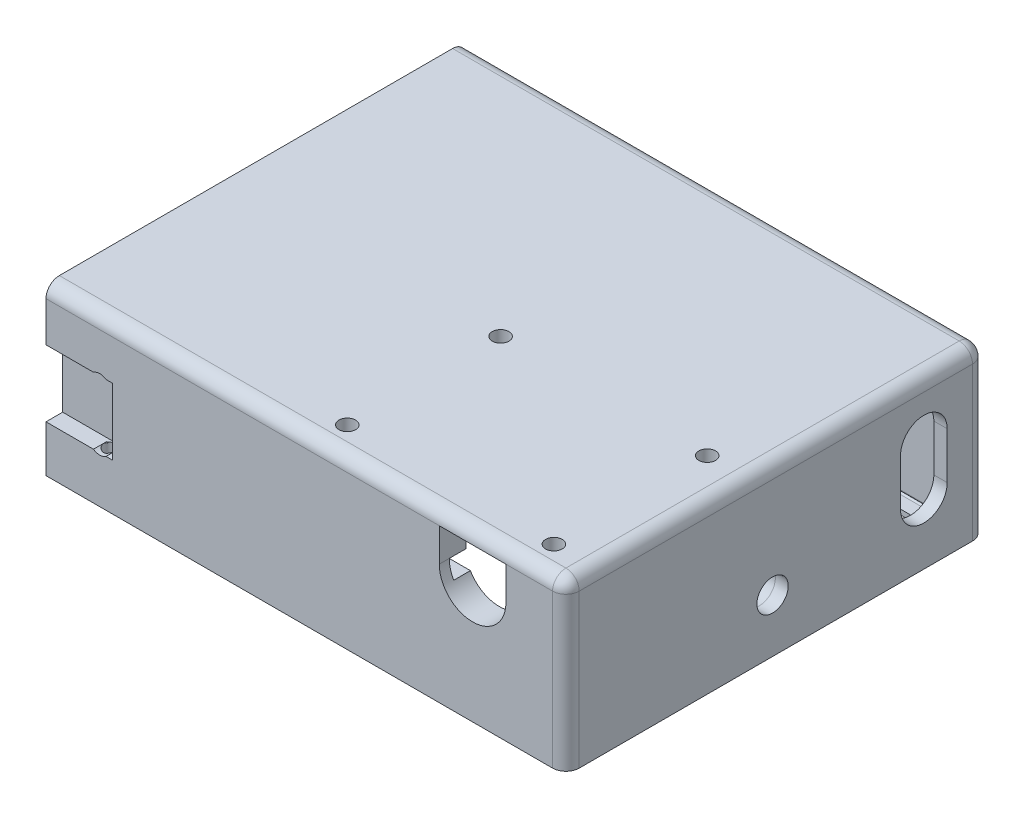
from build123d import *

# Parameters (mm, degrees)
SKETCH1_W               = 80
SKETCH1_H               = 63
BOSS_EXTRUDE2_DEPTH     = 25
SKETCH1_4_W             = 76
SKETCH1_4_H             = 55
CUT_EXTRUDE1_DEPTH      = 23
SKETCH4_W               = 2
SKETCH4_H               = 55
BOSS_EXTRUDE3_DEPTH     = 10
FILLET1_R               = 2
SKETCH5_W               = 2
SKETCH5_H               = 63
CUT_EXTRUDE3_DEPTH      = 105.852277038
SKETCH6_W               = 2.2
SKETCH6_H               = 2.2
CUT_EXTRUDE4_DEPTH      = 76
SKETCH7_W               = 10
SKETCH7_H               = 10
CUT_EXTRUDE5_DEPTH      = 2.5
CUT_EXTRUDE6_DEPTH      = 11.5
CUT_EXTRUDE6_DEPTH_BACK = 1.5
SKETCH8_R               = 0.875
SKETCH9_W               = 10
SKETCH9_H               = 10
CUT_EXTRUDE7_DEPTH      = 2.5
CUT_EXTRUDE8_DEPTH      = 11.5
CUT_EXTRUDE8_DEPTH_BACK = 1.5
SKETCH10_R              = 0.875
CUT_EXTRUDE9_DEPTH      = 2
CUT_EXTRUDE10_DEPTH     = 2
FILLET2_R               = 0.3
CUT_EXTRUDE13_REACH     = 86.524
SKETCH15_W              = 5
SKETCH15_H              = 10
FILLET3_R               = 1
SKETCH18_R              = 2.35
CUT_EXTRUDE16_DEPTH     = 15
CUT_EXTRUDE16_DRAFT     = 2
SKETCH19_R              = 1.25
CUT_EXTRUDE17_DEPTH     = 10
CUT_EXTRUDE18_REACH     = 106.852
SKETCH17_R              = 5
SKETCH20_R              = 3.5
SKETCH20_R_2            = 2.419841539
BOSS_EXTRUDE4_DEPTH     = 5
SKETCH21_R              = 0.75
CUT_EXTRUDE19_DEPTH     = 10
SKETCH22_W              = 38
SKETCH22_H              = 2.5
CUT_EXTRUDE20_DEPTH     = 2.5
SKETCH23_W              = 10
SKETCH23_H              = 5
CUT_EXTRUDE21_DEPTH     = 10
SKETCH24_W              = 12
SKETCH24_H              = 7
CUT_EXTRUDE22_DEPTH     = 2
CUT_EXTRUDE23_DEPTH     = 2


with BuildPart() as part:
    # Sketch1 → Boss-Extrude2 (new body)
    with BuildSketch(Plane(origin=(0, 0, 0), x_dir=(1, 0, 0), z_dir=(0, 1, 0))):
        with Locations((40, 31.5)):
            Rectangle(SKETCH1_W, SKETCH1_H)
    extrude(amount=BOSS_EXTRUDE2_DEPTH)

    # Sketch1<4> → Cut-Extrude1 (cut)
    with BuildSketch(Plane(origin=(0, 0, 0), x_dir=(1, 0, 0), z_dir=(0, 1, 0))):
        with Locations((40, 31.5)):
            Rectangle(SKETCH1_4_W, SKETCH1_4_H)
    extrude(amount=CUT_EXTRUDE1_DEPTH, mode=Mode.SUBTRACT)

    # Sketch4 → Boss-Extrude3 (add)
    with BuildSketch(Plane.XZ.offset(-23)):
        with Locations((30.5, -31.5)):
            Rectangle(SKETCH4_W, SKETCH4_H)
    extrude(amount=BOSS_EXTRUDE3_DEPTH)

    # Fillet1
    fillet1_edges = [part.edges().sort_by_distance(p)[0] for p in [
        (80, 25, -31.5),
        (40, 25, 0),
        (0, 25, -31.5),
        (0, 12.5, 0),
        (80, 12.5, 0),
        (80, 12.5, -63),
        (0, 12.5, -63),
        (40, 25, -63),
    ]]
    fillet(fillet1_edges, radius=FILLET1_R)

    # Sketch5 → Cut-Extrude3 (cut, through all)
    with BuildSketch(Plane(origin=(0, 0, 0), x_dir=(-1, 0, 0), z_dir=(0, -1, 0))):
        with Locations((-1, 31.5)):
            Rectangle(SKETCH5_W, SKETCH5_H)
    extrude(amount=-CUT_EXTRUDE3_DEPTH, mode=Mode.SUBTRACT)

    # Sketch6 → Cut-Extrude4 (cut)
    with BuildSketch(Plane.ZY.offset(-2)):
        with Locations((-2.9, 1.85)):
            Rectangle(SKETCH6_W, SKETCH6_H)
        with Locations((-60.1, 1.85)):
            Rectangle(SKETCH6_W, SKETCH6_H)
    extrude(amount=-CUT_EXTRUDE4_DEPTH, mode=Mode.SUBTRACT)

    # Sketch7 → Cut-Extrude5 (cut)
    with BuildSketch(Plane(origin=(0, 0, -63), x_dir=(-1, 0, 0), z_dir=(0, 0, -1))):
        with Locations((-7, 12)):
            Rectangle(SKETCH7_W, SKETCH7_H)
    extrude(amount=-CUT_EXTRUDE5_DEPTH, mode=Mode.SUBTRACT)

    # Sketch8 → Cut-Extrude6 (cut, two sides: drawn at the far end of the back side and taken through both)
    with BuildSketch(Plane(origin=(0, 7, 0), x_dir=(1, 0, 0), z_dir=(0, 1, 0)).offset(-CUT_EXTRUDE6_DEPTH_BACK)):
        with Locations(Location((10, 61.5, 0), (0, 0, 270))):
            Circle(SKETCH8_R)
    extrude(amount=CUT_EXTRUDE6_DEPTH + CUT_EXTRUDE6_DEPTH_BACK, mode=Mode.SUBTRACT)

    # Sketch9 → Cut-Extrude7 (cut)
    with BuildSketch(Plane.XY):
        with Locations((7, 12)):
            Rectangle(SKETCH9_W, SKETCH9_H)
    extrude(amount=-CUT_EXTRUDE7_DEPTH, mode=Mode.SUBTRACT)

    # Sketch10 → Cut-Extrude8 (cut, two sides: drawn at the far end of the back side and taken through both)
    with BuildSketch(Plane(origin=(0, 7, 0), x_dir=(1, 0, 0), z_dir=(0, 1, 0)).offset(-CUT_EXTRUDE8_DEPTH_BACK)):
        with Locations((10, 1.5)):
            Circle(SKETCH10_R)
    extrude(amount=CUT_EXTRUDE8_DEPTH + CUT_EXTRUDE8_DEPTH_BACK, mode=Mode.SUBTRACT)

    # Sketch11 → Cut-Extrude9 (cut)
    with BuildSketch(Plane(origin=(0, 0, -63), x_dir=(-1, 0, 0), z_dir=(0, 0, -1))):
        with BuildLine():
            Line((-9.122986176, 7), (-10.8, 7))
            add(Edge.make_bspline(
                [(-10.8, 7), (-9.980201359, 6.395551325), (-9.122986176, 7)],
                knots=[0, 0, 0, 1, 1, 1], degree=2))
        make_face()
        with BuildLine():
            Line((-9.122986176, 17), (-10.8, 17))
            add(Edge.make_bspline(
                [(-10.8, 17), (-9.980201359, 17.604448675), (-9.122986176, 17)],
                knots=[0, 0, 0, 1, 1, 1], degree=2))
        make_face()
    extrude(amount=-CUT_EXTRUDE9_DEPTH, mode=Mode.SUBTRACT)

    # Sketch12 → Cut-Extrude10 (cut)
    with BuildSketch(Plane.XY):
        with BuildLine():
            Line((11, 7), (9.120131213, 7))
            add(Edge.make_bspline(
                [(11, 7), (10.05659536, 6.399803182), (9.120131213, 7)],
                knots=[0, 0, 0, 1, 1, 1], degree=2))
        make_face()
        with BuildLine():
            Line((11, 17), (9.120131213, 17))
            add(Edge.make_bspline(
                [(11, 17), (10.05659536, 17.600196818), (9.120131213, 17)],
                knots=[0, 0, 0, 1, 1, 1], degree=2))
        make_face()
    extrude(amount=-CUT_EXTRUDE10_DEPTH, mode=Mode.SUBTRACT)

    # Fillet2
    fillet2_edges = [part.edges().sort_by_distance(p)[0] for p in [
        (40, 2.95, -59),
        (2, 0.75, -60.1),
        (2, 1.85, -61.2),
        (40, 0.75, -61.2),
        (40, 2.95, -61.2),
        (2, 2.95, -60.1),
        (2, 2.95, -2.9),
        (40, 2.95, -4),
        (40, 2.95, -1.8),
        (40, 0.75, -1.8),
        (2, 0.75, -2.9),
        (2, 1.85, -1.8),
    ]]
    fillet(fillet2_edges, radius=FILLET2_R)

    # Sketch15 → Cut-Extrude13 (cut, up to next)
    with BuildSketch(Plane.ZY.offset(-29.5), mode=Mode.PRIVATE) as cut_extrude13_sk1:
        with Locations((-6.5, 18)):
            Rectangle(SKETCH15_W, SKETCH15_H)
    cut_extrude13_tool1 = extrude(cut_extrude13_sk1.sketch, amount=-CUT_EXTRUDE13_REACH, mode=Mode.PRIVATE) & part.part
    add(cut_extrude13_tool1.solids().sort_by_distance((29.5, 18, -6.5))[0], mode=Mode.SUBTRACT)

    # Fillet3
    fillet3_edges = [part.edges().sort_by_distance(p)[0] for p in [
        (29.5, 13, -34),
        (30.5, 13, -9),
        (29.5, 18, -59),
        (31.5, 18, -59),
        (30.5, 13, -59),
        (31.5, 13, -34),
    ]]
    fillet(fillet3_edges, radius=FILLET3_R - 0.0001)  # a hair under: the kernel refuses the full size


with BuildPart() as cut_extrude16_tool:
    # Sketch18 → Cut-Extrude16 (with draft: the straight prism first)
    with BuildSketch(Plane(origin=(80, 0, 0), x_dir=(0, 0, -1), z_dir=(1, 0, 0))):
        with Locations((31, 8)):
            Circle(SKETCH18_R)
    extrude(amount=-CUT_EXTRUDE16_DEPTH)
    # Cut-Extrude16: the draft: its side faces are tilted about the plane it starts from
    cut_extrude16_sides = [cut_extrude16_tool.faces().sort_by_distance(p)[0] for p in [
        (72.5, 8, -28.65),
    ]]
    draft(cut_extrude16_sides, Plane(origin=(80, 0, 0), x_dir=(0, 0, -1), z_dir=(1, 0, 0)), CUT_EXTRUDE16_DRAFT)


with BuildPart() as part_1:
    add(part.part)

    # Cut-Extrude16: cut by cut_extrude16_tool
    add(cut_extrude16_tool.part, mode=Mode.SUBTRACT)

    # Sketch19 → Cut-Extrude17 (cut)
    with BuildSketch(Plane.XZ.offset(-23)):
        with Locations(Location((74, -4.2, 0), (0, 0, 270))):
            Circle(SKETCH19_R)
        with Locations(Location((74, -27.2, 0), (0, 0, 270))):
            Circle(SKETCH19_R)
        with Locations(Location((43, -27.2, 0), (0, 0, 270))):
            Circle(SKETCH19_R)
        with Locations(Location((43, -4.2, 0), (0, 0, 270))):
            Circle(SKETCH19_R)
    extrude(amount=-CUT_EXTRUDE17_DEPTH, mode=Mode.SUBTRACT)

    # Sketch17 → Cut-Extrude18 (cut, up to next)
    with BuildSketch(Plane.XY, mode=Mode.PRIVATE) as cut_extrude18_sk1:
        with Locations(Location((66, 18, 0), (0, 0, 90))):
            Circle(SKETCH17_R)
    cut_extrude18_tool1 = extrude(cut_extrude18_sk1.sketch, amount=-CUT_EXTRUDE18_REACH, mode=Mode.PRIVATE) & part_1.part
    add(cut_extrude18_tool1.solids().sort_by_distance((66, 18, 0))[0], mode=Mode.SUBTRACT)

    # Sketch20 → Boss-Extrude4 (add)
    with BuildSketch(Plane.ZY.offset(-78)):
        with Locations((-31, 8)):
            Circle(SKETCH20_R)
        with Locations((-31, 8)):
            Circle(SKETCH20_R_2, mode=Mode.SUBTRACT)
    extrude(amount=BOSS_EXTRUDE4_DEPTH)

    # Sketch21 → Cut-Extrude19 (cut)
    with BuildSketch(Plane.XY.offset(-59)):
        with Locations((76.7, 20.5)):
            Circle(SKETCH21_R)
        with Locations((76.7, 5.5)):
            Circle(SKETCH21_R)
        with Locations((36.2, 5.5)):
            Circle(SKETCH21_R)
        with Locations((36.2, 20.5)):
            Circle(SKETCH21_R)
    extrude(amount=-CUT_EXTRUDE19_DEPTH, mode=Mode.SUBTRACT)

    # Sketch22 → Cut-Extrude20 (cut)
    with BuildSketch(Plane(origin=(0, 0, -4), x_dir=(-1, 0, 0), z_dir=(0, 0, -1))):
        with Locations((-59, 16.75)):
            Rectangle(SKETCH22_W, SKETCH22_H)
    extrude(amount=-CUT_EXTRUDE20_DEPTH, mode=Mode.SUBTRACT)

    # Sketch23 → Cut-Extrude21 (cut)
    with BuildSketch(Plane.XY):
        with Locations((66, 20.5)):
            Rectangle(SKETCH23_W, SKETCH23_H)
    extrude(amount=-CUT_EXTRUDE21_DEPTH, mode=Mode.SUBTRACT)

    # Sketch24 → Cut-Extrude22 (cut)
    with BuildSketch(Plane(origin=(0, 0, -4), x_dir=(-1, 0, 0), z_dir=(0, 0, -1))):
        with Locations((-52, 16.5)):
            Rectangle(SKETCH24_W, SKETCH24_H)
    extrude(amount=-CUT_EXTRUDE22_DEPTH, mode=Mode.SUBTRACT)

    # Sketch18<3> → Cut-Extrude23 (cut)
    with BuildSketch(Plane(origin=(80, 0, 0), x_dir=(0, 0, -1), z_dir=(1, 0, 0))):
        with BuildLine():
            Line((57.2, 16.5), (57.2, 9.5))
            ThreePointArc((57.2, 9.5), (53.7, 6), (50.2, 9.5))
            Line((50.2, 9.5), (50.2, 16.5))
            ThreePointArc((50.2, 16.5), (53.7, 20), (57.2, 16.5))
        make_face()
    extrude(amount=-CUT_EXTRUDE23_DEPTH, mode=Mode.SUBTRACT)


solid = part_1.part
